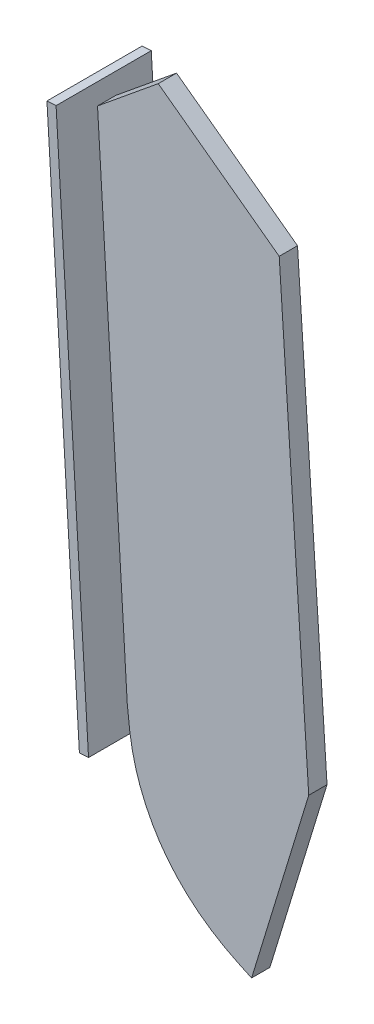
from build123d import *

# Parameters (mm, degrees)
EXTRUDE_1_DEPTH     = 1.2
CUT_EXTRUDE_START   = -1.2
CUT_EXTRUDE_1_DEPTH = 1.2
SKETCH_3_R          = 0.3
EXTRUDE_2_DEPTH     = 0.3
SKETCH_4_W          = 6.240890377
SKETCH_4_H          = 36.021981299
EXTRUDE_3_DEPTH     = 0.6


# Read off the part's stored shape, not the designer's step: Вырез-Вытянуть-Тонкостенный1
with BuildPart() as part:
    # Эскиз1 → Бобышка-Вытянуть1 (new body)
    with BuildSketch(Plane.XY):
        with BuildLine():
            Line((5.378881308, 18.237319105), (-2.952136628, 24.369097407))
            Line((-2.952136628, 24.369097407), (-7.332317287, 20.785313231))
            Line((-7.332317287, 20.785313231), (-5.370009146, -12.399066019))
            add(Edge.make_bspline(
                [(-5.370009146, -12.399066019), (-5.302441643, -13.087933403), (-5.171652717, -14.4213588), (-4.705894041, -16.337224351), (-3.980118415, -18.073869331), (-3.037863831, -19.656891462), (-1.854751161, -21.069611208), (-0.442865037, -22.322015124), (1.210414163, -23.402243504), (2.432125444, -23.961998582), (3.062087221, -24.250630037)],
                knots=[0, 0, 0, 0, 0.134544415, 0.260434655, 0.381864625, 0.499402401, 0.617479097, 0.738843694, 0.865337667, 1, 1, 1, 1], degree=3))
            Line((3.062087221, -24.250630037), (3.44414449, -24.369097407))
            Line((3.44414449, -24.369097407), (7.332317287, -11.660532618))
            Line((7.332317287, -11.660532618), (5.378881308, 18.237319105))
        make_face()
    extrude(amount=EXTRUDE_1_DEPTH)

    # Вырез-Вытянуть-Тонкостенный1 outline → Вырез-Вытянуть-Тонкостенный1 (cut)
    with BuildSketch(Plane.XY.offset(1.2).offset(CUT_EXTRUDE_START)):
        with BuildLine():
            Line((-7.332317287, 20.785313231), (-5.370009146, -12.399066019))
            add(Edge.make_bspline(
                [(-5.370009146, -12.399066019), (-5.302441643, -13.087933403), (-5.171652717, -14.4213588), (-4.705894041, -16.337224351), (-3.980118415, -18.073869331), (-3.037863831, -19.656891462), (-1.854751161, -21.069611208), (-0.442865037, -22.322015124), (1.210414163, -23.402243504), (2.432125444, -23.961998582), (3.062087221, -24.250630037)],
                knots=[0, 0, 0, 0, 0.134544415, 0.260434655, 0.381864625, 0.499402401, 0.617479097, 0.738843694, 0.865337667, 1, 1, 1, 1], degree=3))
            Line((3.062087221, -24.250630037), (3.44414449, -24.369097407))
            Line((3.44414449, -24.369097407), (7.332317287, -11.660532618))
            Line((7.332317287, -11.660532618), (5.378881308, 18.237319105))
            Line((5.378881308, 18.237319105), (-2.952136628, 24.369097407))
            Line((-2.952136628, 24.369097407), (-7.332317287, 20.785313231))
        make_face()
        with BuildLine():
            add(Edge.make_bspline(
                [(-4.971163716, -12.367724843), (-4.910437592, -12.986836229), (-4.849676357, -13.605939574), (-4.654543085, -14.827292297), (-4.518019632, -15.429049084), (-4.24283568, -16.315565722), (-4.139152476, -16.608333995), (-3.907848144, -17.188389699), (-3.77968372, -17.476760574), (-3.366686296, -18.319539943), (-3.053087929, -18.855873767), (-2.517467922, -19.616879364), (-2.327928668, -19.863212785), (-1.927678486, -20.341760794), (-1.716167659, -20.574779068), (-1.056114397, -21.24716639), (-0.586382585, -21.656301106), (0.408094083, -22.402093404), (0.932873325, -22.738705687), (2.037021143, -23.34001134), (2.608653164, -23.602856812), (3.180150897, -23.864736725)],
                knots=[0, 0, 0, 0, 0.125, 0.125, 0.25, 0.25, 0.3125, 0.3125, 0.375, 0.375, 0.5, 0.5, 0.5625, 0.5625, 0.625, 0.625, 0.75, 0.75, 0.875, 0.875, 1, 1, 1, 1], degree=3))
            Line((-4.971163716, -12.367724843), (-6.920959218, 20.605054546))
            Line((-6.920959218, 20.605054546), (-2.939165367, 23.862885878))
            Line((-2.939165367, 23.862885878), (4.991867828, 18.025503503))
            Line((4.991867828, 18.025503503), (6.928393761, -11.61353551))
            Line((6.928393761, -11.61353551), (3.180150897, -23.864736725))
        make_face(mode=Mode.SUBTRACT)
    extrude(amount=CUT_EXTRUDE_1_DEPTH, mode=Mode.SUBTRACT)

    # Эскиз3 → Бобышка-Вытянуть2 (add)
    with BuildSketch(Plane(origin=(-5.682639561, -0.336034307, 0), x_dir=(0, 0, 1), z_dir=(-0.9982561871654927, -0.059030371723486505, 0))):
        with Locations(Location((0.6, 20.377669982, 0), (0, 0, 270))):
            Circle(SKETCH_3_R)
        with Locations(Location((0.6, 9.777669982, 0), (0, 0, 270))):
            Circle(SKETCH_3_R)
        with Locations(Location((0.6, -0.822330018, 0), (0, 0, 270))):
            Circle(SKETCH_3_R)
        with Locations(Location((0.6, -11.422330018, 0), (0, 0, 270))):
            Circle(SKETCH_3_R)
    extrude(amount=EXTRUDE_2_DEPTH)

    # Эскиз4 → Бобышка-Вытянуть3 (add)
    with BuildSketch(Plane(origin=(-5.982116417, -0.353743418, 0), x_dir=(0, 0, 1), z_dir=(-0.9982561871654927, -0.05903037172348652, 0))):
        with Locations((0.435766043, 4.003532813)):
            Rectangle(SKETCH_4_W, SKETCH_4_H)
    extrude(amount=EXTRUDE_3_DEPTH)


solid = part.part
